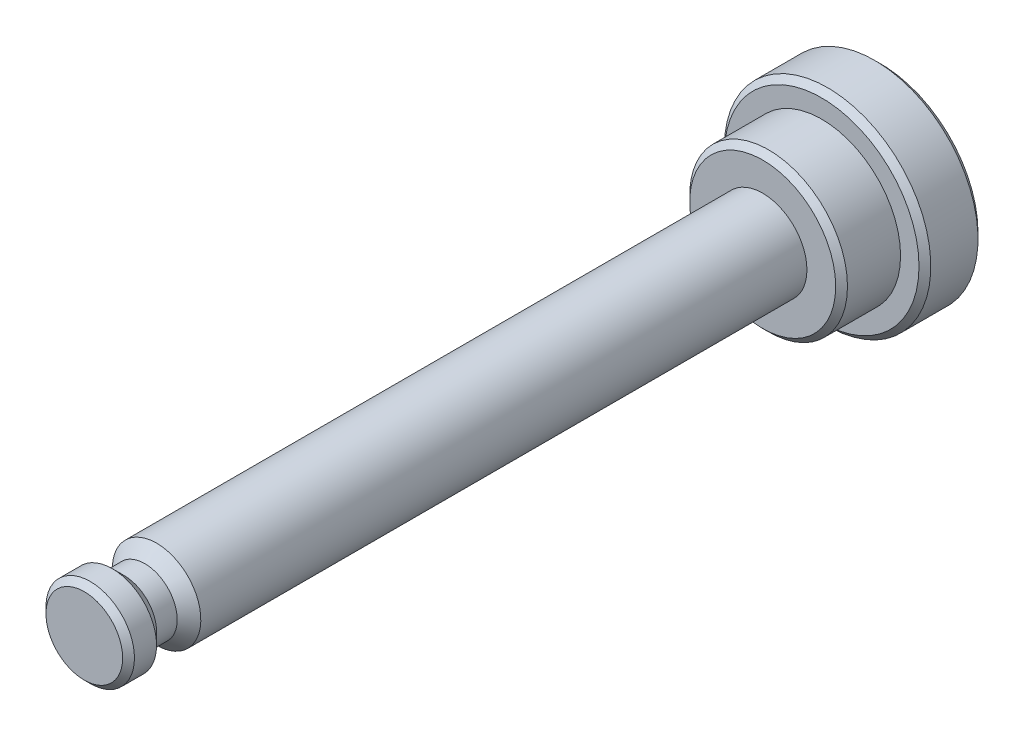
from build123d import *

# Parameters (mm, degrees)
SKETCH1_R         = 2.675
COUNTERSINK_DEPTH = 2
SKETCH2_R         = 1.5
SHAFT_DEPTH       = 23
SKETCH3_R         = 3.5
HEAD_DEPTH        = 2
DEBURS_SIZE       = 0.2


with BuildPart() as part:
    # Sketch1 → Countersink (new body)
    with BuildSketch(Plane.XY):
        Circle(SKETCH1_R)
    extrude(amount=-COUNTERSINK_DEPTH)

    # Sketch2 → Shaft (add)
    with BuildSketch(Plane.XY):
        Circle(SKETCH2_R)
    extrude(amount=SHAFT_DEPTH)

    # Sketch3 → Head (add)
    with BuildSketch(Plane(origin=(0, 0, -2), x_dir=(-1, 0, 0), z_dir=(0, 0, -1))):
        Circle(SKETCH3_R)
    extrude(amount=HEAD_DEPTH)

    # Sketch4 → e-Clip Notch (revolve, cut)
    with BuildSketch(Plane(origin=(0, 0, 0), x_dir=(0, 0, -1), z_dir=(1, 0, 0))):
        Polygon((-22.05, 1.5), (-20.55, 1.5), (-20.95, 1.1), (-21.65, 1.1), align=None)
    revolve(axis=Axis((0, 0, 0), (0, 0, 1)), mode=Mode.SUBTRACT)

    # Deburs
    deburs_edges = [part.edges().sort_by_distance(p)[0] for p in [
        (-1.5, 0, 23),
        (3.5, 0, -2),
        (3.5, 0, -4),
        (-2.675, 0, 0),
    ]]
    chamfer(deburs_edges, length=DEBURS_SIZE)


solid = part.part
